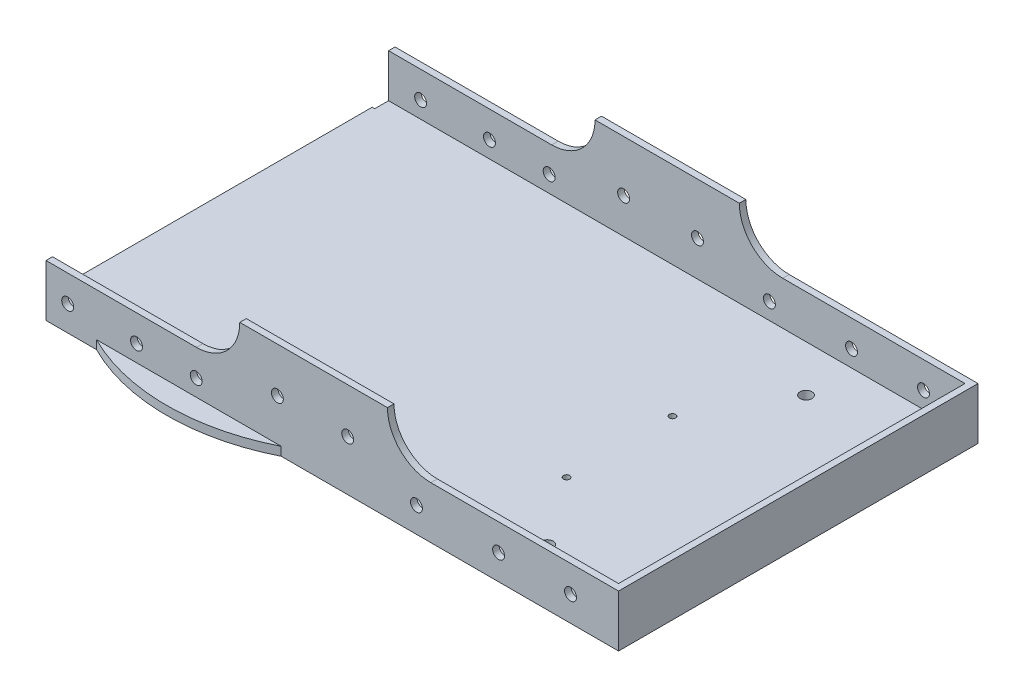
from build123d import *

# Parameters (mm, degrees)
SKETCH1_W              = 278.049859422
SKETCH1_H              = 166.000659628
BOSS_EXTRUDE1_DEPTH    = 24
SKETCH2_W              = 21.890830047
SKETCH2_H              = 145.09871859
CUT_EXTRUDE1_DEPTH     = 325.721331793
SKETCH3_W              = 272.049859422
SKETCH3_H              = 160.000659628
CUT_EXTRUDE2_DEPTH     = 20
SKETCH4_W              = 68.204970116
SKETCH4_H              = 3
BOSS_EXTRUDE2_DEPTH    = 20
FILLET4_R              = 20
FILLET5_R              = 20
SKETCH5_W              = 66.657615254
SKETCH5_H              = 3
BOSS_EXTRUDE3_DEPTH    = 20
FILLET6_R              = 20
FILLET7_R              = 20
SKETCH6_R              = 2.75
HOLESFORBOLTS1_DEPTH   = 326.295157302
SKETCH7_R              = 2.75
CUT_EXTRUDE4_DEPTH     = 327.808725896
SKETCH8_R              = 2.75
CUT_EXTRUDE5_DEPTH     = 20
SKETCH11_W             = 13.646136269
SKETCH11_H             = 11.541733762
CUT_EXTRUDE6_DEPTH     = 327.808725896
SKETCH12_W             = 8.844116654
SKETCH12_H             = 9.360207276
CUT_EXTRUDE7_DEPTH     = 327.808725896
HOLESINLIDFORPICOVER_R = 2.75
CUT_EXTRUDE8_DEPTH     = 4
LIDHOLESFORPI_R        = 1.455
CUT_EXTRUDE9_DEPTH     = 4
SKETCH14_R             = 2.75
CUT_EXTRUDE10_DEPTH    = 4
SKETCH15_R             = 95
BOSS_EXTRUDE4_DEPTH    = 4
SKETCH16_W             = 38.061392729
SKETCH16_H             = 124.714605982
CUT_EXTRUDE11_DEPTH    = 4


with BuildPart() as part:
    # Sketch1 → Boss-Extrude1 (new body)
    with BuildSketch(Plane(origin=(0, 0, 0), x_dir=(1, 0, 0), z_dir=(0, 1, 0))):
        with Locations((139.024929711, 83.000329814)):
            Rectangle(SKETCH1_W, SKETCH1_H)
    extrude(amount=BOSS_EXTRUDE1_DEPTH)

    # Sketch2 → Cut-Extrude1 (cut, through all)
    with BuildSketch(Plane(origin=(0, 0, 0), x_dir=(-1, 0, 0), z_dir=(0, -1, 0))):
        with Locations((3.29477533, 84.091093057)):
            Rectangle(SKETCH2_W, SKETCH2_H)
    extrude(amount=-CUT_EXTRUDE1_DEPTH, mode=Mode.SUBTRACT)

    # Sketch3 → Cut-Extrude2 (cut)
    with BuildSketch(Plane(origin=(0, 24, 0), x_dir=(1, 0, 0), z_dir=(0, 1, 0))):
        with Locations((139.024929711, 83.000329814)):
            Rectangle(SKETCH3_W, SKETCH3_H)
    extrude(amount=-CUT_EXTRUDE2_DEPTH, mode=Mode.SUBTRACT)

    # Sketch4 → Boss-Extrude2 (add)
    with BuildSketch(Plane(origin=(0, 24, 0), x_dir=(1, 0, 0), z_dir=(0, 1, 0))):
        with Locations((137.24279725, 1.5)):
            Rectangle(SKETCH4_W, SKETCH4_H)
    extrude(amount=BOSS_EXTRUDE2_DEPTH)

    # Fillet4
    fillet4_edges = [part.edges().sort_by_distance(p)[0] for p in [
        (103.140312192, 24, -1.5),
    ]]
    fillet(fillet4_edges, radius=FILLET4_R - 0.0001)  # a hair under: the kernel refuses the full size

    # Fillet5
    fillet5_edges = [part.edges().sort_by_distance(p)[0] for p in [
        (171.345282308, 24, -1.5),
    ]]
    fillet(fillet5_edges, radius=FILLET5_R - 0.0001)  # a hair under: the kernel refuses the full size

    # Sketch5 → Boss-Extrude3 (add)
    with BuildSketch(Plane(origin=(0, 24, 0), x_dir=(1, 0, 0), z_dir=(0, 1, 0))):
        with Locations((137.51551703, 164.500659628)):
            Rectangle(SKETCH5_W, SKETCH5_H)
    extrude(amount=BOSS_EXTRUDE3_DEPTH)

    # Fillet6
    fillet6_edges = [part.edges().sort_by_distance(p)[0] for p in [
        (104.186709403, 24, -164.500659628),
    ]]
    fillet(fillet6_edges, radius=FILLET6_R - 0.0001)  # a hair under: the kernel refuses the full size

    # Fillet7
    fillet7_edges = [part.edges().sort_by_distance(p)[0] for p in [
        (170.844324657, 24, -164.500659628),
    ]]
    fillet(fillet7_edges, radius=FILLET7_R - 0.0001)  # a hair under: the kernel refuses the full size

    # Sketch6 → HolesForBolts1 (cut, through all)
    with BuildSketch(Plane.XY.offset(-163.000659628)):
        with Locations((151.506445743, 20.306027196)):
            Circle(SKETCH6_R)
        with Locations((117.392557181, 20.306027196)):
            Circle(SKETCH6_R)
    extrude(amount=-HOLESFORBOLTS1_DEPTH, mode=Mode.SUBTRACT)

    # Sketch7 → Cut-Extrude4 (cut, through all)
    with BuildSketch(Plane(origin=(0, 0, -166.000659628), x_dir=(-1, 0, 0), z_dir=(0, 0, -1))):
        with Locations((-23.654153003, 11.675842417)):
            Circle(SKETCH7_R)
        with Locations((-55.441477074, 11.675842417)):
            Circle(SKETCH7_R)
        with Locations((-83.004388954, 11.675842417)):
            Circle(SKETCH7_R)
        with Locations((-184.727610529, 11.675842417)):
            Circle(SKETCH7_R)
        with Locations((-222.645451091, 11.675842417)):
            Circle(SKETCH7_R)
        with Locations((-255.881733076, 11.675842417)):
            Circle(SKETCH7_R)
    extrude(amount=-CUT_EXTRUDE4_DEPTH, mode=Mode.SUBTRACT)

    # Sketch8 → Cut-Extrude5 (cut)
    with BuildSketch(Plane(origin=(0, 0, -3), x_dir=(-1, 0, 0), z_dir=(0, 0, -1))):
        with Locations((-120.487078085, 23.280365191)):
            Circle(SKETCH8_R)
        with Locations((-152.966291723, 23.280365191)):
            Circle(SKETCH8_R)
    extrude(amount=-CUT_EXTRUDE5_DEPTH, mode=Mode.SUBTRACT)

    # Sketch11 → Cut-Extrude6 (cut, through all)
    with BuildSketch(Plane.XZ):
        with Locations((6.823068135, -5.770866881)):
            Rectangle(SKETCH11_W, SKETCH11_H)
    extrude(amount=-CUT_EXTRUDE6_DEPTH, mode=Mode.SUBTRACT)

    # Sketch12 → Cut-Extrude7 (cut, through all)
    with BuildSketch(Plane.XZ):
        with Locations((4.422058327, -161.32055599)):
            Rectangle(SKETCH12_W, SKETCH12_H)
    extrude(amount=-CUT_EXTRUDE7_DEPTH, mode=Mode.SUBTRACT)

    # HolesInLidForPiCover → Cut-Extrude8 (cut)
    with BuildSketch(Plane.XZ):
        with Locations(Location((223.013799051, -141.608636884, 0), (0, 0, 270))):
            Circle(HOLESINLIDFORPICOVER_R)
        with Locations(Location((223.013799051, -22.129735073, 0), (0, 0, 270))):
            Circle(HOLESINLIDFORPICOVER_R)
    extrude(amount=-CUT_EXTRUDE8_DEPTH, mode=Mode.SUBTRACT)

    # LidHolesForPi → Cut-Extrude9 (cut)
    with BuildSketch(Plane.XZ):
        with Locations(Location((200.562123112, -102.370703816, 0), (0, 0, 270))):
            Circle(LIDHOLESFORPI_R)
        with Locations(Location((200.562123112, -53.502923562, 0), (0, 0, 270))):
            Circle(LIDHOLESFORPI_R)
        with Locations(Location((258.544947711, -53.502923562, 0), (0, 0, 270))):
            Circle(LIDHOLESFORPI_R)
        with Locations(Location((258.544947711, -102.370703816, 0), (0, 0, 270))):
            Circle(LIDHOLESFORPI_R)
    extrude(amount=-CUT_EXTRUDE9_DEPTH, mode=Mode.SUBTRACT)

    # Sketch14 → Cut-Extrude10 (cut)
    with BuildSketch(Plane.XZ):
        with Locations(Location((264.763568483, -18.920123653, 0), (0, 0, 270))):
            Circle(SKETCH14_R)
        with Locations(Location((181.616848195, -18.918729826, 0), (0, 0, 270))):
            Circle(SKETCH14_R)
    extrude(amount=-CUT_EXTRUDE10_DEPTH, mode=Mode.SUBTRACT)

    # Sketch15 → Boss-Extrude4 (add)
    with BuildSketch(Plane.XZ):
        with Locations((79.590839171, -84.881114817)):
            Circle(SKETCH15_R)
    extrude(amount=-BOSS_EXTRUDE4_DEPTH)

    # Sketch16 → Cut-Extrude11 (cut)
    with BuildSketch(Plane.XZ):
        with Locations((-11.380056671, -85.193210909)):
            Rectangle(SKETCH16_W, SKETCH16_H)
    extrude(amount=-CUT_EXTRUDE11_DEPTH, mode=Mode.SUBTRACT)


solid = part.part
